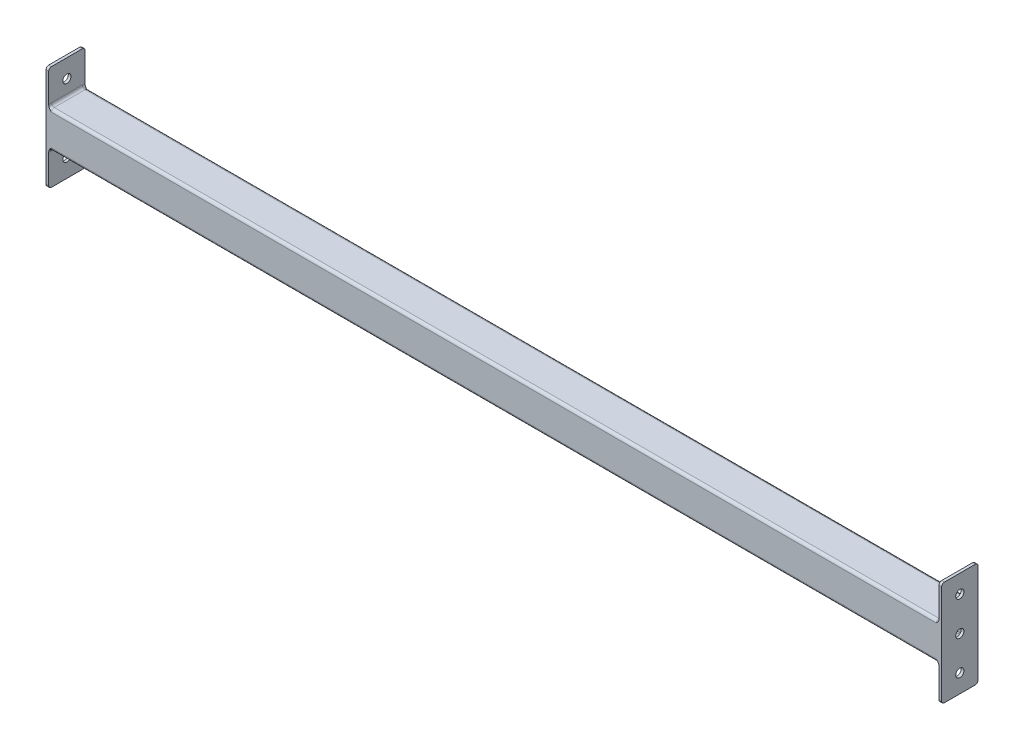
from build123d import *

# Parameters (mm, degrees)
SKETCH1_W           = 40
SKETCH1_H           = 40
SKETCH1_W_2         = 34
SKETCH1_H_2         = 34
BOSS_EXTRUDE1_DEPTH = 489.5
FILLET1_R           = 1
FILLET2_R           = 3
SKETCH2_W           = 40
SKETCH2_H           = 115
SKETCH2_R           = 4.5
BOSS_EXTRUDE2_DEPTH = 3
FILLET3_R           = 3
FILLET4_R           = 3


with BuildPart() as part:
    # Sketch1 → Boss-Extrude1 (new body)
    with BuildSketch(Plane(origin=(0, 0, 0), x_dir=(0, 0, -1), z_dir=(1, 0, 0))):
        Rectangle(SKETCH1_W, SKETCH1_H)
        Rectangle(SKETCH1_W_2, SKETCH1_H_2, mode=Mode.SUBTRACT)
    extrude(amount=BOSS_EXTRUDE1_DEPTH)

    # Fillet1
    fillet1_edges = [part.edges().sort_by_distance(p)[0] for p in [
        (244.75, -17, -17),
        (244.75, 17, -17),
        (244.75, 17, 17),
        (244.75, -17, 17),
    ]]
    fillet(fillet1_edges, radius=FILLET1_R)

    # Fillet2
    fillet2_edges = [part.edges().sort_by_distance(p)[0] for p in [
        (244.75, -20, -20),
        (244.75, -20, 20),
        (244.75, 20, 20),
        (244.75, 20, -20),
    ]]
    fillet(fillet2_edges, radius=FILLET2_R)

    # Sketch2 → Boss-Extrude2 (add)
    with BuildSketch(Plane(origin=(489.5, 0, 0), x_dir=(0, 0, -1), z_dir=(1, 0, 0))):
        Rectangle(SKETCH2_W, SKETCH2_H)
        Circle(SKETCH2_R, mode=Mode.SUBTRACT)
        with Locations((0, -37.5)):
            Circle(SKETCH2_R, mode=Mode.SUBTRACT)
        with Locations((0, 37.5)):
            Circle(SKETCH2_R, mode=Mode.SUBTRACT)
    extrude(amount=BOSS_EXTRUDE2_DEPTH)

    # Fillet3
    # the kernel refuses this fillet: 3 mm, written as the material it adds along each edge
    with BuildSketch(Plane(origin=(489.5, -20, 17), x_dir=(0, -1, 0), z_dir=(0, 0, -1)), Plane(origin=(489.5, 20, -17), x_dir=(0, 1, 0), z_dir=(0, 0, 1))) as fillet3_piece_1:
        with BuildLine():
            CenterArc((FILLET3_R, FILLET3_R), FILLET3_R, 180, 90)
            Line((0, FILLET3_R), (0, 0))
            Line((0, 0), (FILLET3_R, 0))
        make_face()
    extrude(amount=34)
    with BuildSketch(Plane(origin=(489.5, 17, 17), x_dir=(0, 1, 0), z_dir=(0, 0, -1))) as fillet3_piece_2_section:
        with BuildLine():
            CenterArc((3 + FILLET3_R, -FILLET3_R), FILLET3_R, 90, 90)
            Line((3, -FILLET3_R), (3, 0))
            Line((3, 0), (3 + FILLET3_R, 0))
        make_face()
    fillet3_piece_2 = revolve(axis=Axis((489.5, 17, 17), (1, 0, 0)), revolution_arc=233.296989237, mode=Mode.PRIVATE)
    fillet3_piece_2 = split(fillet3_piece_2, bisect_by=Plane(origin=(488.998099396, 20.659325751, 20), z_dir=(0, 0, -1)), keep=Keep.TOP, mode=Mode.PRIVATE)
    fillet3_piece_2 = split(fillet3_piece_2, bisect_by=Plane(origin=(488.998099396, 20.659325751, 17), z_dir=(0, 0, 1)), keep=Keep.TOP, mode=Mode.PRIVATE)
    add(fillet3_piece_2)
    with BuildSketch(Plane(origin=(489.5, 17, -17), x_dir=(0, -0.5976672776328276, 0.8017442392976482), z_dir=(0, 0.8017442392976482, 0.5976672776328276))) as fillet3_piece_3_section:
        with BuildLine():
            CenterArc((3 + FILLET3_R, -FILLET3_R), FILLET3_R, 90, 90)
            Line((3, -FILLET3_R), (3, 0))
            Line((3, 0), (3 + FILLET3_R, 0))
        make_face()
    fillet3_piece_3 = revolve(axis=Axis((489.5, 17, -17), (1, 0, 0)), revolution_arc=233.296989237, mode=Mode.PRIVATE)
    fillet3_piece_3 = split(fillet3_piece_3, bisect_by=Plane(origin=(488.565115083, 19.249816872, -20), z_dir=(0, 0, 1)), keep=Keep.TOP, mode=Mode.PRIVATE)
    fillet3_piece_3 = split(fillet3_piece_3, bisect_by=Plane(origin=(488.565115083, 19.249816872, -17), z_dir=(0, 0, -1)), keep=Keep.TOP, mode=Mode.PRIVATE)
    add(fillet3_piece_3)
    with BuildSketch(Plane(origin=(489.5, -17, -17), x_dir=(0, -1, 0), z_dir=(0, 0, 1))) as fillet3_piece_4_section:
        with BuildLine():
            CenterArc((3 + FILLET3_R, -FILLET3_R), FILLET3_R, 90, 90)
            Line((3, -FILLET3_R), (3, 0))
            Line((3, 0), (3 + FILLET3_R, 0))
        make_face()
    fillet3_piece_4 = revolve(axis=Axis((489.5, -17, -17), (1, 0, 0)), revolution_arc=233.296989237, mode=Mode.PRIVATE)
    fillet3_piece_4 = split(fillet3_piece_4, bisect_by=Plane(origin=(488.998099396, -20.659325751, -20), z_dir=(0, 0, 1)), keep=Keep.TOP, mode=Mode.PRIVATE)
    fillet3_piece_4 = split(fillet3_piece_4, bisect_by=Plane(origin=(488.998099396, -20.659325751, -17), z_dir=(0, 0, -1)), keep=Keep.TOP, mode=Mode.PRIVATE)
    add(fillet3_piece_4)
    with BuildSketch(Plane(origin=(489.5, -17, 17), x_dir=(0, -1, 0), z_dir=(0, 0, -1))) as fillet3_piece_5_section:
        with BuildLine():
            CenterArc((3 + FILLET3_R, FILLET3_R), FILLET3_R, 180, 90)
            Line((3, FILLET3_R), (3, 0))
            Line((3, 0), (3 + FILLET3_R, 0))
        make_face()
    fillet3_piece_5 = revolve(axis=Axis((489.5, -17, 17), (-1, 0, 0)), revolution_arc=233.296989237, mode=Mode.PRIVATE)
    fillet3_piece_5 = split(fillet3_piece_5, bisect_by=Plane(origin=(488.998099366, -20.659325736, 20), z_dir=(0, 0, -1)), keep=Keep.TOP, mode=Mode.PRIVATE)
    fillet3_piece_5 = split(fillet3_piece_5, bisect_by=Plane(origin=(488.998099366, -20.659325736, 17), z_dir=(0, 0, 1)), keep=Keep.TOP, mode=Mode.PRIVATE)
    add(fillet3_piece_5)

    # Fillet4
    fillet4_edges = [part.edges().sort_by_distance(p)[0] for p in [
        (491, -57.5, -20),
        (491, 57.5, -20),
        (491, 57.5, 20),
        (491, -57.5, 20),
    ]]
    fillet(fillet4_edges, radius=FILLET4_R)

    # Mirror1: part across plane


with BuildPart() as part_1:
    add(part.part)
    add(part.part.mirror(Plane(origin=(0, 0, 0), x_dir=(0, 0, 1), z_dir=(1, 0, 0))))


solid = part_1.part
